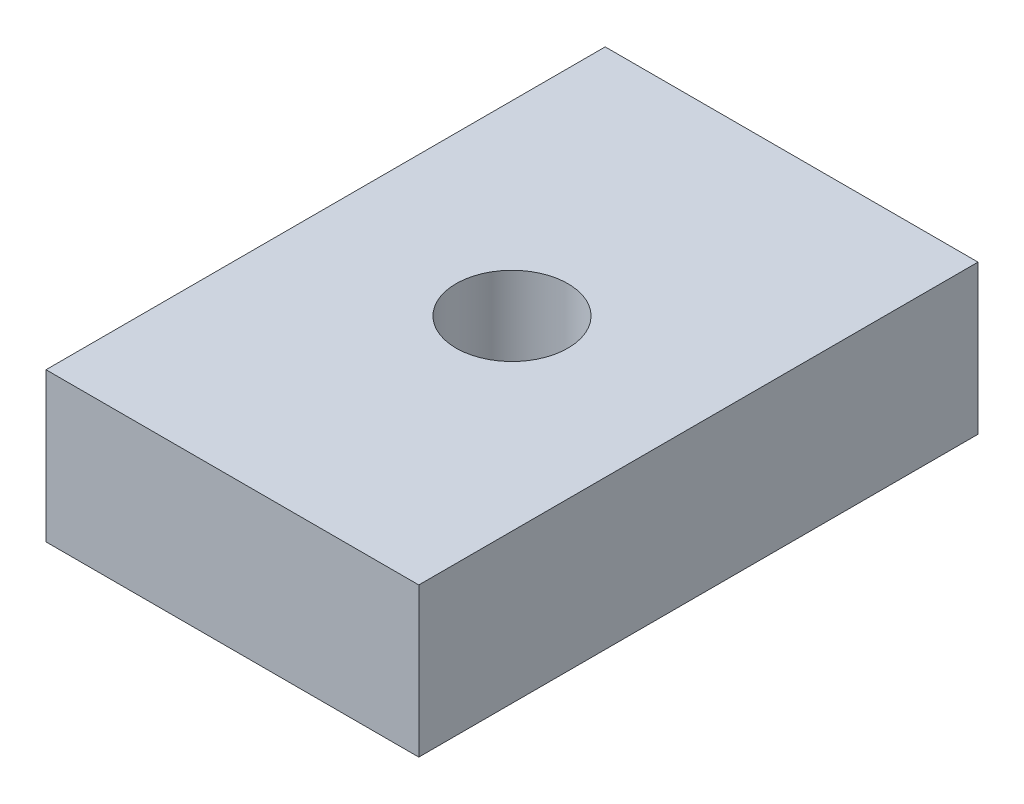
from build123d import *

# Parameters (mm, degrees)
SKETCH2_W                    = 15
SKETCH2_H                    = 4
PROFILEBOSS_EXTRUDE1_DEPTH   = 10
MOUNTHOLESSKETCH5_R          = 1.5
MOUNTHOLESCUT_EXTRUDE2_DEPTH = 19.466185313


with BuildPart() as part:
    # Sketch2 → ProfileBoss-Extrude1 (new body)
    with BuildSketch(Plane(origin=(0, 0, 0), x_dir=(0, 0, -1), z_dir=(1, 0, 0))):
        with Locations((7.5, 2)):
            Rectangle(SKETCH2_W, SKETCH2_H)
    extrude(amount=PROFILEBOSS_EXTRUDE1_DEPTH)

    # MountHolesSketch5 → MountHolesCut-Extrude2 (cut, through all)
    with BuildSketch(Plane(origin=(0, 4, 0), x_dir=(1, 0, 0), z_dir=(0, 1, 0))):
        with Locations((5, 7.5)):
            Circle(MOUNTHOLESSKETCH5_R)
    extrude(amount=-MOUNTHOLESCUT_EXTRUDE2_DEPTH, mode=Mode.SUBTRACT)


solid = part.part
